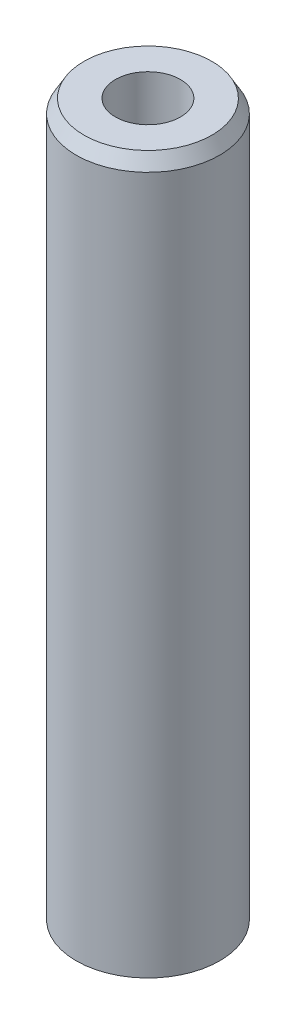
from build123d import *
from OCP.BRepFilletAPI import BRepFilletAPI_MakeChamfer

# Parameters (mm, degrees)
SKETCH1_R           = 5
BOSS_EXTRUDE1_DEPTH = 50.101986437
SKETCH2_R           = 2.266072476
CUT_EXTRUDE1_DEPTH  = 51.598508328
CHAMFER1_SIZE       = 0.93808266
CHAMFER1_SIZE2      = 0.541602276


with BuildPart() as part:
    # Sketch1 → Boss-Extrude1 (new body)
    with BuildSketch(Plane(origin=(0, 0, 0), x_dir=(1, 0, 0), z_dir=(0, 1, 0))):
        Circle(SKETCH1_R)
    extrude(amount=BOSS_EXTRUDE1_DEPTH)

    # Sketch2 → Cut-Extrude1 (cut, through all)
    with BuildSketch(Plane(origin=(0, 0, 0), x_dir=(1, 0, 0), z_dir=(0, 1, 0))):
        Circle(SKETCH2_R)
    extrude(amount=CUT_EXTRUDE1_DEPTH, mode=Mode.SUBTRACT)

    # Chamfer1: one chamfer whose edges measure the first distance from different faces: ONE call of the kernel's chamfer builder (chamfer() names one face for all edges)
    chamfer1_edges_1 = [part.edges().sort_by_distance(p)[0] for p in [
        (-5, 50.101986437, 0),
    ]]
    chamfer1_side_1 = [part.faces().sort_by_distance(p)[0] for p in [
        (-5, 25.050993219, 0),
    ]]
    chamfer1_edges_2 = [part.edges().sort_by_distance(p)[0] for p in [
        (-5, 0, 0),
    ]]
    chamfer1_side_2 = [part.faces().sort_by_distance(p)[0] for p in [
        (-4.858578644, 0, 0),
    ]]
    chamfer1 = BRepFilletAPI_MakeChamfer(part.part.solid().wrapped)
    for e in chamfer1_edges_1:
        chamfer1.Add(CHAMFER1_SIZE, CHAMFER1_SIZE2, e.wrapped, chamfer1_side_1[0].wrapped)  # the first distance lies on this face
    for e in chamfer1_edges_2:
        chamfer1.Add(CHAMFER1_SIZE, CHAMFER1_SIZE2, e.wrapped, chamfer1_side_2[0].wrapped)  # the first distance lies on this face
    add(Compound.cast(chamfer1.Shape()), mode=Mode.REPLACE)


solid = part.part
